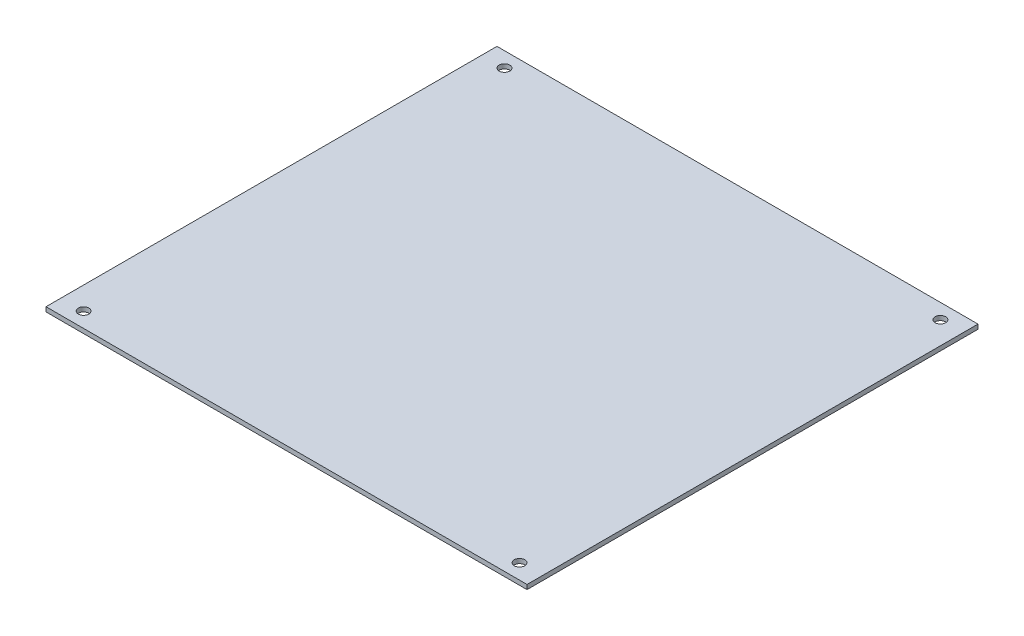
from build123d import *

# Parameters (mm, degrees)
CROQUIS1_W              = 160
CROQUIS1_H              = 150
CROQUIS1_R              = 1.75
SALIENTE_EXTRUIR1_DEPTH = 1.5


with BuildPart() as part:
    # Croquis1 → Saliente-Extruir1 (new body)
    with BuildSketch(Plane(origin=(0, 0, 0), x_dir=(1, 0, 0), z_dir=(0, 1, 0))):
        Rectangle(CROQUIS1_W, CROQUIS1_H)
        with Locations((-72.5, 70)):
            Circle(CROQUIS1_R, mode=Mode.SUBTRACT)
        with Locations((72.5, 70)):
            Circle(CROQUIS1_R, mode=Mode.SUBTRACT)
        with Locations((72.5, -70)):
            Circle(CROQUIS1_R, mode=Mode.SUBTRACT)
        with Locations((-72.5, -70)):
            Circle(CROQUIS1_R, mode=Mode.SUBTRACT)
    extrude(amount=SALIENTE_EXTRUIR1_DEPTH)


solid = part.part
